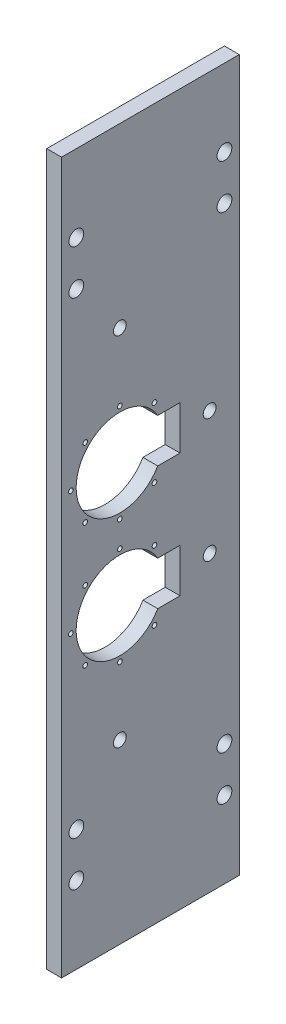
from build123d import *

# Parameters (mm, degrees)
SKETCH1_W              = 609.6
SKETCH1_H              = 152.4
SKETCH1_R              = 2
SKETCH1_R_2            = 6.35
BOSS_EXTRUDE1_DEPTH    = 6.35
M12X1_0_TAPPED_HOLE1_D = 11


with BuildPart() as part:
    # Sketch1 → Boss-Extrude1 (new, symmetric)
    with BuildSketch(Plane.YZ):
        Rectangle(SKETCH1_W, SKETCH1_H)
        with Locations((53, 68.2)):
            Circle(SKETCH1_R, mode=Mode.SUBTRACT)
        with Locations((82.69848481, 55.89848481)):
            Circle(SKETCH1_R, mode=Mode.SUBTRACT)
        with Locations((95, 26.2)):
            Circle(SKETCH1_R, mode=Mode.SUBTRACT)
        with Locations((82.69848481, -3.49848481)):
            Circle(SKETCH1_R, mode=Mode.SUBTRACT)
        with Locations((23.30151519, -3.49848481)):
            Circle(SKETCH1_R, mode=Mode.SUBTRACT)
        with Locations((11, 26.2)):
            Circle(SKETCH1_R, mode=Mode.SUBTRACT)
        with Locations((23.30151519, 55.89848481)):
            Circle(SKETCH1_R, mode=Mode.SUBTRACT)
        with Locations((238.76, 63.5)):
            Circle(SKETCH1_R_2, mode=Mode.SUBTRACT)
        with Locations((200.66, 63.5)):
            Circle(SKETCH1_R_2, mode=Mode.SUBTRACT)
        with Locations((200.66, -63.5)):
            Circle(SKETCH1_R_2, mode=Mode.SUBTRACT)
        with Locations((238.76, -63.5)):
            Circle(SKETCH1_R_2, mode=Mode.SUBTRACT)
        with Locations((-200.66, 63.5)):
            Circle(SKETCH1_R_2, mode=Mode.SUBTRACT)
        with Locations((-238.76, 63.5)):
            Circle(SKETCH1_R_2, mode=Mode.SUBTRACT)
        with Locations((-238.76, -63.5)):
            Circle(SKETCH1_R_2, mode=Mode.SUBTRACT)
        with Locations((-200.66, -63.5)):
            Circle(SKETCH1_R_2, mode=Mode.SUBTRACT)
        with Locations((-82.69848481, -3.49848481)):
            Circle(SKETCH1_R, mode=Mode.SUBTRACT)
        with Locations((-95, 26.2)):
            Circle(SKETCH1_R, mode=Mode.SUBTRACT)
        with Locations((-82.69848481, 55.89848481)):
            Circle(SKETCH1_R, mode=Mode.SUBTRACT)
        with Locations((-53, 68.2)):
            Circle(SKETCH1_R, mode=Mode.SUBTRACT)
        with Locations((-23.30151519, 55.89848481)):
            Circle(SKETCH1_R, mode=Mode.SUBTRACT)
        with Locations((-11, 26.2)):
            Circle(SKETCH1_R, mode=Mode.SUBTRACT)
        with Locations((-23.30151519, -3.49848481)):
            Circle(SKETCH1_R, mode=Mode.SUBTRACT)
        with BuildLine():
            Line((34.25, -6.275952642), (34.25, -25.4))
            Line((34.25, -25.4), (71.75, -25.4))
            Line((71.75, -25.4), (71.75, -6.275952642))
            ThreePointArc((71.75, -6.275952642), (53, 63.7), (34.25, -6.275952642))
        make_face(mode=Mode.SUBTRACT)
        with BuildLine():
            Line((-34.25, -25.4), (-71.75, -25.4))
            Line((-71.75, -25.4), (-71.75, -6.275952642))
            ThreePointArc((-71.75, -6.275952642), (-53, 63.7), (-34.25, -6.275952642))
            Line((-34.25, -6.275952642), (-34.25, -25.4))
        make_face(mode=Mode.SUBTRACT)
    extrude(amount=BOSS_EXTRUDE1_DEPTH, both=True)

    # M12x1.0 Tapped Hole1 (through all)
    with Locations(Plane(origin=(6.35, 0, 0), x_dir=(0, 0, -1), z_dir=(1, 0, 0))):
        with Locations((50.8, 53), (-26.2, 153), (50.8, -53), (-26.2, -153)):
            Hole(M12X1_0_TAPPED_HOLE1_D / 2)


solid = part.part
